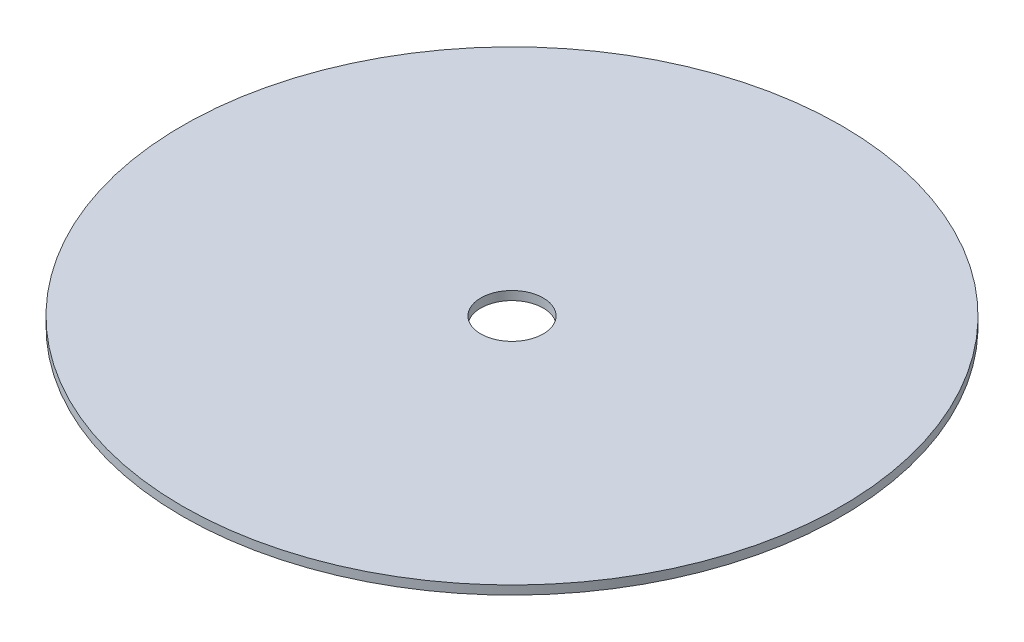
from build123d import *

# Parameters (mm, degrees)
SKETCH1_R           = 150
BOSS_EXTRUDE1_DEPTH = 4
SKETCH2_R           = 14.2
CUT_EXTRUDE1_DEPTH  = 10


with BuildPart() as part:
    # Sketch1 → Boss-Extrude1 (new body)
    with BuildSketch(Plane(origin=(0, 0, 0), x_dir=(1, 0, 0), z_dir=(0, 1, 0))):
        Circle(SKETCH1_R)
    extrude(amount=BOSS_EXTRUDE1_DEPTH)

    # Sketch2 → Cut-Extrude1 (cut)
    with BuildSketch(Plane.XZ):
        Circle(SKETCH2_R)
    extrude(amount=-CUT_EXTRUDE1_DEPTH, mode=Mode.SUBTRACT)


solid = part.part
